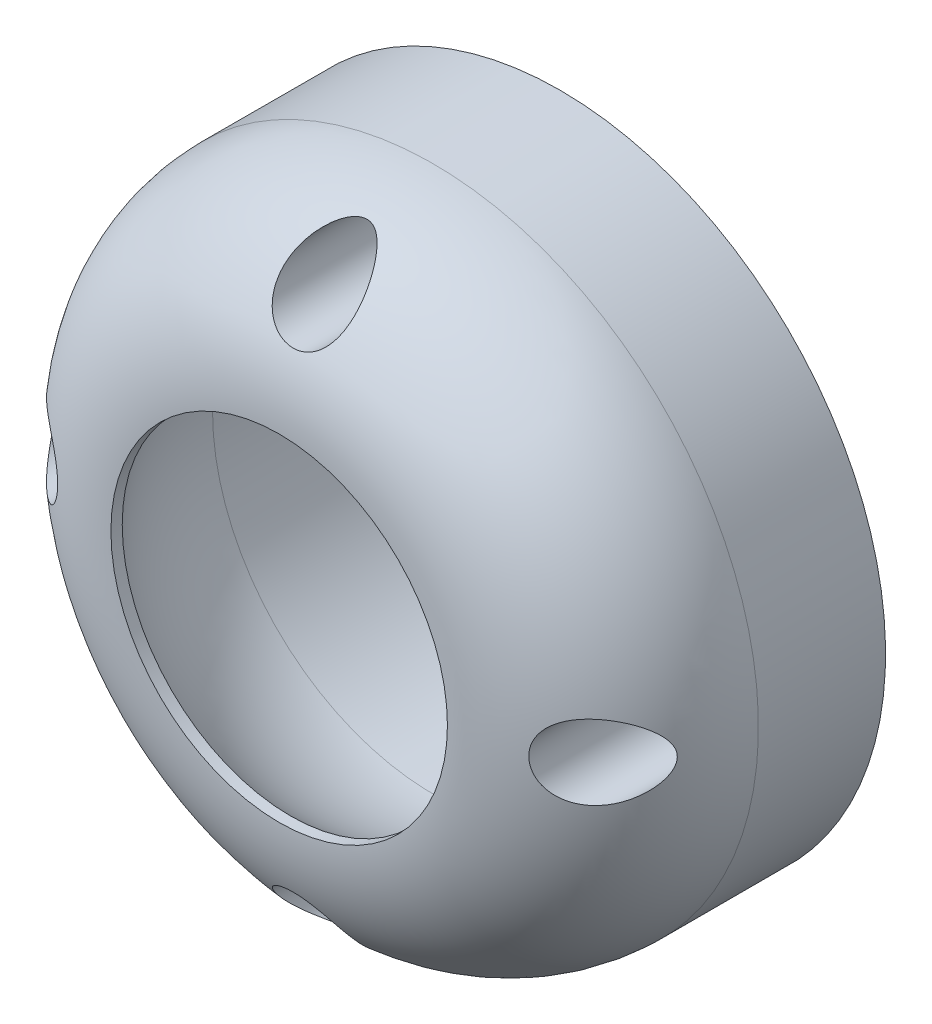
from build123d import *

# Parameters (mm, degrees)
REVOLVE_1_ANGLE     = 180
SKETCH_2_R          = 11.25
CUT_EXTRUDE_1_DEPTH = 27.413774815
SKETCH_3_R          = 21.75
SKETCH_3_R_2        = 14.75
EXTRUDE_1_DEPTH     = 8.5
SKETCH_7_R          = 1.1
CUT_EXTRUDE_2_DEPTH = 37.048238436
CUT_EXTRUDE_START   = -6.5
SKETCH_8_R          = 2.5
CUT_EXTRUDE_7_DEPTH = 39.937107898


with BuildPart() as part:
    # ｽｹｯﾁ1 → 回転1 (revolve)
    with BuildSketch(Plane.XY):
        with BuildLine():
            Line((-15.25, 0), (-14.75, 0))
            ThreePointArc((-14.75, 0), (0, -14.75), (14.75, 0))
            Line((14.75, 0), (15.25, 0))
            ThreePointArc((15.25, 0), (0, -15.25), (-15.25, 0))
        make_face()
    revolve(axis=Axis((14.75, 0, 0), (-1, 0, 0)), revolution_arc=REVOLVE_1_ANGLE)

    # ｽｹｯﾁ2 → ｶｯﾄ - 押し出し1 (cut, through all)
    with BuildSketch(Plane(origin=(0, 0, 0), x_dir=(-1, 0, 0), z_dir=(0, 0, -1))):
        Circle(SKETCH_2_R)
    extrude(amount=-CUT_EXTRUDE_1_DEPTH, mode=Mode.SUBTRACT)

    # ｽｹｯﾁ4 → 回転2 (revolve)
    with BuildSketch(Plane(origin=(0, 0, 0), x_dir=(0, 0, -1), z_dir=(1, 0, 0))):
        with BuildLine():
            Line((0, 15.25), (0, 21.75))
            ThreePointArc((0, 21.75), (-7.352720585, 18.661989683), (-10.295630141, 11.25))
            ThreePointArc((-10.295630141, 11.25), (-5.522680509, 14.214868976), (0, 15.25))
        make_face()
    revolve(axis=Axis((0, 0, 0), (0, 0, 1)))

    # ｽｹｯﾁ3 → ﾎﾞｽ - 押し出し1 (add)
    with BuildSketch(Plane(origin=(0, 0, 0), x_dir=(-1, 0, 0), z_dir=(0, 0, -1))):
        Circle(SKETCH_3_R)
        Circle(SKETCH_3_R_2, mode=Mode.SUBTRACT)
    extrude(amount=EXTRUDE_1_DEPTH)

    # ｽｹｯﾁ7 → ｶｯﾄ - 押し出し2 (cut, through all)
    with BuildSketch(Plane(origin=(0, 0, -8.5), x_dir=(-1, 0, 0), z_dir=(0, 0, -1))):
        with Locations((0, -18.25)):
            Circle(SKETCH_7_R)
        with Locations((-18.25, 0)):
            Circle(SKETCH_7_R)
        with Locations((0, 18.25)):
            Circle(SKETCH_7_R)
        with Locations((18.25, 0)):
            Circle(SKETCH_7_R)
    extrude(amount=-CUT_EXTRUDE_2_DEPTH, mode=Mode.SUBTRACT)

    # ｽｹｯﾁ8 → ｶｯﾄ - 押し出し7 (cut, through all)
    with BuildSketch(Plane.XY.offset(CUT_EXTRUDE_START)):
        with Locations((0, 18.25)):
            Circle(SKETCH_8_R)
        with Locations((18.25, 0)):
            Circle(SKETCH_8_R)
        with Locations((0, -18.25)):
            Circle(SKETCH_8_R)
        with Locations((-18.25, 0)):
            Circle(SKETCH_8_R)
    extrude(amount=CUT_EXTRUDE_7_DEPTH, mode=Mode.SUBTRACT)


solid = part.part
